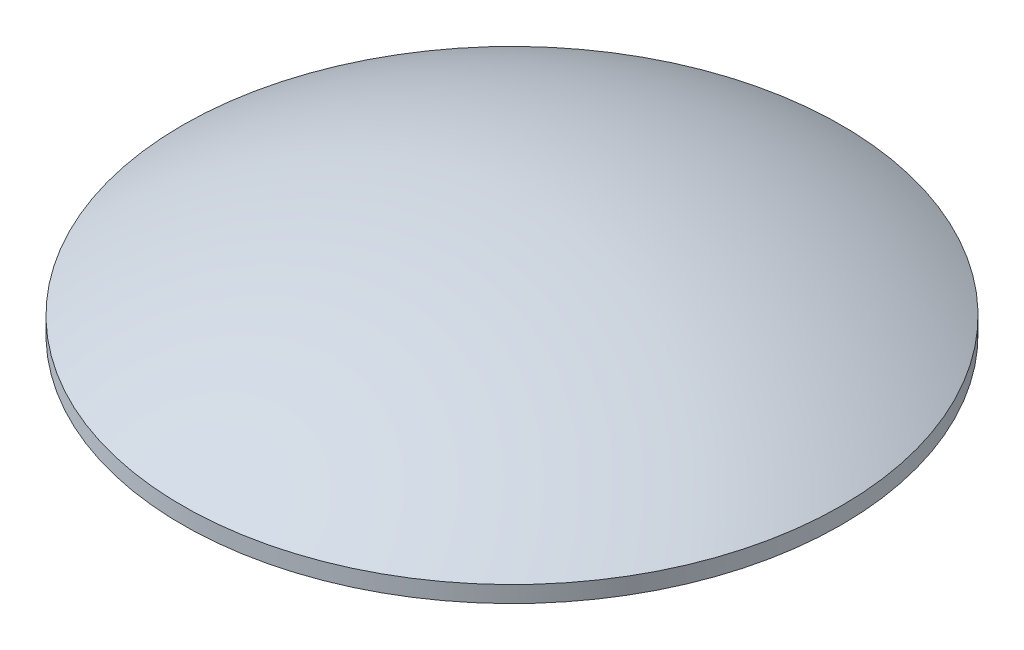
from build123d import *


with BuildPart() as part:
    # Эскиз1 → Повернуть1 (revolve)
    with BuildSketch(Plane.XY):
        with BuildLine():
            Line((0, 10), (0, 0))
            Line((0, 0), (30, 0))
            Line((30, 0), (30, 1.5))
            ThreePointArc((30, 1.5), (15.590461828, 7.833982921), (0, 10))
        make_face()
    revolve(axis=Axis((0, 0, 0), (0, 1, 0)))


solid = part.part
